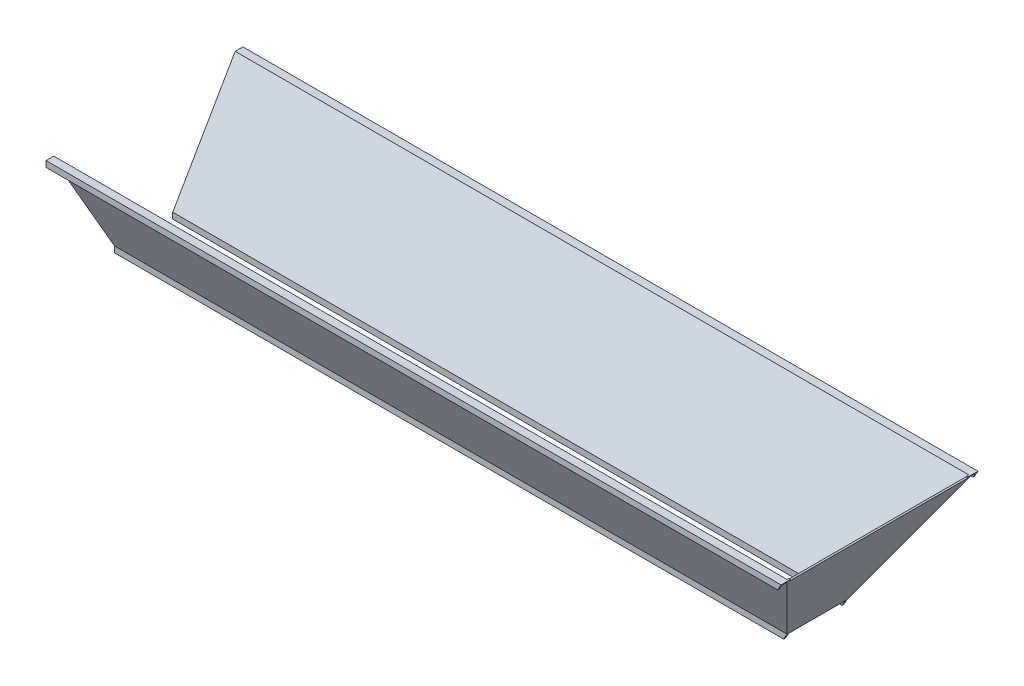
from build123d import *

# Parameters (mm, degrees)
CHUTE_CENTER_DEPTH         = 127
CHUTE_SIDES_REACH          = 3146.77
SHELL1_T                   = -6.35
BOSS_EXTRUDE3_REACH        = 3168.434
SHELL3_DEPTH               = 3105.098368864
BOSS_EXTRUDE4_REACH        = 3171.67
SHELL5_DEPTH               = 3105.098368864
SKETCH11_W                 = 752.729086146
SKETCH11_H                 = 10
CLOSED_END_RELIEF_DEPTH    = 10
LOWER_SUPPORT_FLANGE_REACH = 3171.67
SKETCH12_W                 = 7.332348419
SKETCH12_H                 = 25.4


# Read off the part's stored shape, not the designer's step: Shell3, Shell5
with BuildPart() as part:
    # Sketch1 → Chute Center (new, symmetric)
    with BuildSketch(Plane.XY):
        Polygon((0, 0), (2844.8, 0), (3108.764543073, 457.2), (0, 457.2), align=None)
    extrude(amount=CHUTE_CENTER_DEPTH, both=True)

    # Chute Sides: up to this plane
    chute_sides_end = Plane(origin=(2844.8, 0, 127), z_dir=(-0.8660254037844399, 0.49999999999999784, 0))
    # Sketch2 → Chute Sides (add, up to the surface)
    with BuildSketch(Plane.ZY, mode=Mode.PRIVATE) as chute_sides_sk1:
        Polygon((127, 0), (390.964543073, 457.2), (127, 457.2), align=None)
    chute_sides_tool1 = split(extrude(chute_sides_sk1.sketch, amount=-CHUTE_SIDES_REACH, mode=Mode.PRIVATE), bisect_by=chute_sides_end, keep=Keep.BOTH, mode=Mode.PRIVATE)
    add(chute_sides_tool1.solids().sort_by_distance((0, 304.8, 214.988181))[0])
    # Sketch2 → Chute Sides (add, up to the surface)
    with BuildSketch(Plane.ZY, mode=Mode.PRIVATE) as chute_sides_sk2:
        Polygon((-127, 457.2), (-390.964543073, 457.2), (-127, 0), align=None)
    chute_sides_tool2 = split(extrude(chute_sides_sk2.sketch, amount=-CHUTE_SIDES_REACH, mode=Mode.PRIVATE), bisect_by=chute_sides_end, keep=Keep.BOTH, mode=Mode.PRIVATE)
    add(chute_sides_tool2.solids().sort_by_distance((0, 304.8, -214.988181))[0])

    # Shell1
    shell1_openings = [part.faces().sort_by_distance(p)[0] for p in [
        (1554.382271537, 457.2, 0),
        (1422.4, 0, 0),
        (0, 267.432963474, 0),
    ]]
    offset(amount=SHELL1_T, openings=shell1_openings, kind=Kind.INTERSECTION)

    # Boss-Extrude3: up to this plane
    boss_extrude3_end = Plane(origin=(2844.8, 0, 127), z_dir=(-0.8660254037844399, 0.49999999999999784, 0))
    # Sketch6 → Boss-Extrude3 (add, up to the surface)
    with BuildSketch(Plane(origin=(0, 0, 0), x_dir=(0, 0, -1), z_dir=(1, 0, 0)), mode=Mode.PRIVATE) as boss_extrude3_sk1:
        Polygon((390.964543073, 457.2), (416.364543073, 457.2), (416.364543073, 431.8), (376.299846236, 431.8), align=None)
    boss_extrude3_tool1 = split(extrude(boss_extrude3_sk1.sketch, amount=BOSS_EXTRUDE3_REACH, mode=Mode.PRIVATE), bisect_by=boss_extrude3_end, keep=Keep.BOTH, mode=Mode.PRIVATE)
    add(boss_extrude3_tool1.solids().sort_by_distance((0, 443.551694, -399.724617))[0])

    # Shell3 outline → Shell3 (cut)
    with BuildSketch(Plane.YZ):
        Polygon((450.85, -410.014543073), (450.85, -387.298368864), (431.8, -376.299846236), (431.8, -410.014543073), align=None)
    extrude(amount=SHELL3_DEPTH, mode=Mode.SUBTRACT)

    # Boss-Extrude4: up to this plane
    boss_extrude4_end = Plane(origin=(2844.8, 0, 127), z_dir=(-0.8660254037844399, 0.49999999999999784, 0))
    # Sketch7 → Boss-Extrude4 (add, up to the surface)
    with BuildSketch(Plane(origin=(0, 0, 0), x_dir=(0, 0, -1), z_dir=(1, 0, 0)), mode=Mode.PRIVATE) as boss_extrude4_sk1:
        Polygon((-390.964543073, 457.2), (-416.364543073, 457.2), (-416.364543073, 431.8), (-376.299846236, 431.8), align=None)
    boss_extrude4_tool1 = split(extrude(boss_extrude4_sk1.sketch, amount=BOSS_EXTRUDE4_REACH, mode=Mode.PRIVATE), bisect_by=boss_extrude4_end, keep=Keep.BOTH, mode=Mode.PRIVATE)
    add(boss_extrude4_tool1.solids().sort_by_distance((0, 443.551694, 399.724617))[0])

    # Shell5 outline → Shell5 (cut)
    with BuildSketch(Plane.YZ):
        Polygon((450.85, 387.298368864), (450.85, 410.014543073), (431.8, 410.014543073), (431.8, 376.299846236), align=None)
    extrude(amount=SHELL5_DEPTH, mode=Mode.SUBTRACT)

    # Sketch11 → Closed End Relief (cut)
    with BuildSketch(Plane(origin=(2133.6, -1231.834534343, 0), x_dir=(0, 0, -1), z_dir=(0.86602540378444, -0.49999999999999784, 0))):
        with Locations((0, 1945.329086147)):
            Rectangle(SKETCH11_W, SKETCH11_H)
    extrude(amount=-CLOSED_END_RELIEF_DEPTH, mode=Mode.SUBTRACT)

    # Lower Support Flange: up to this plane
    lower_support_flange_end = Plane(origin=(2844.8, 0, 127), z_dir=(-0.8660254037844399, 0.49999999999999784, 0))
    # Sketch12 → Lower Support Flange (add, up to the surface)
    with BuildSketch(Plane(origin=(0, 0, 0), x_dir=(0, 0, -1), z_dir=(1, 0, 0)), mode=Mode.PRIVATE) as lower_support_flange_sk1:
        with Locations((123.333825791, -12.7)):
            Rectangle(SKETCH12_W, SKETCH12_H)
    lower_support_flange_tool1 = split(extrude(lower_support_flange_sk1.sketch, amount=LOWER_SUPPORT_FLANGE_REACH, mode=Mode.PRIVATE), bisect_by=lower_support_flange_end, keep=Keep.BOTH, mode=Mode.PRIVATE)
    add(lower_support_flange_tool1.solids().sort_by_distance((0, -12.7, -123.333826))[0])
    # Sketch12 → Lower Support Flange (add, up to the surface)
    with BuildSketch(Plane(origin=(0, 0, 0), x_dir=(0, 0, -1), z_dir=(1, 0, 0)), mode=Mode.PRIVATE) as lower_support_flange_sk2:
        with Locations((-123.333825791, -12.7)):
            Rectangle(SKETCH12_W, SKETCH12_H)
    lower_support_flange_tool2 = split(extrude(lower_support_flange_sk2.sketch, amount=LOWER_SUPPORT_FLANGE_REACH, mode=Mode.PRIVATE), bisect_by=lower_support_flange_end, keep=Keep.BOTH, mode=Mode.PRIVATE)
    add(lower_support_flange_tool2.solids().sort_by_distance((0, -12.7, 123.333826))[0])


solid = part.part
